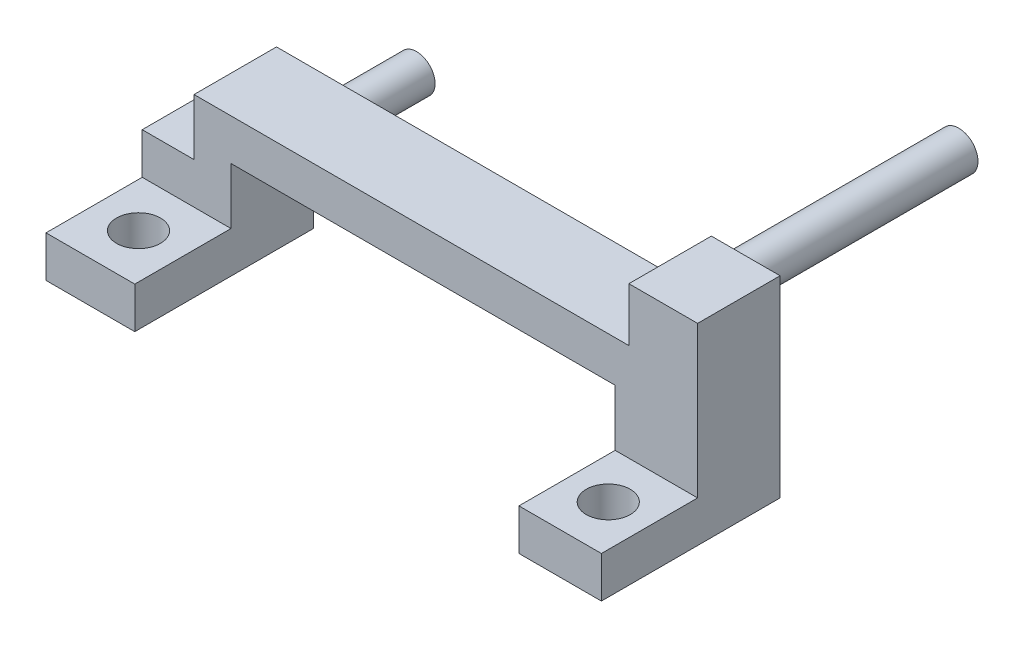
from build123d import *

# Parameters (mm, degrees)
SKETCH1_W            = 4
SKETCH1_H            = 14
BOSS_EXTRUDE1_DEPTH  = 3
SKETCH2_R            = 1.4
BOSS_EXTRUDE2_DEPTH  = 16
SKETCH3_W            = 4
SKETCH3_H            = 1
BOSS_EXTRUDE4_DEPTH  = 6
SKETCH7_W            = 3
SKETCH7_H            = 2
BOSS_EXTRUDE5_DEPTH  = 30.95
SKETCH8_W            = 3
SKETCH8_H            = 2
BOSS_EXTRUDE6_DEPTH  = 1
SKETCH9_W            = 1
SKETCH9_H            = 2
BOSS_EXTRUDE7_DEPTH  = 3
SKETCH10_W           = 1
SKETCH10_H           = 2
BOSS_EXTRUDE8_DEPTH  = 5.92
SKETCH11_W           = 1
SKETCH11_H           = 2
BOSS_EXTRUDE9_DEPTH  = 4
SKETCH12_W           = 1
SKETCH12_H           = 3
BOSS_EXTRUDE14_DEPTH = 0.93
SKETCH13_W           = 3
SKETCH13_H           = 3
BOSS_EXTRUDE15_DEPTH = 7.1
SKETCH14_W           = 3.33402541
SKETCH14_H           = 13.860919233
CUT_EXTRUDE3_DEPTH   = 10
SKETCH15_W           = 6.20666024
SKETCH15_H           = 3.660501205
CUT_EXTRUDE4_DEPTH   = 10
SKETCH16_W           = 3
SKETCH16_H           = 9.1
BOSS_EXTRUDE16_DEPTH = 0.12
SKETCH18_W           = 3
SKETCH18_H           = 9.1
BOSS_EXTRUDE18_DEPTH = 0.41
SKETCH19_W           = 3
SKETCH19_H           = 9.1
BOSS_EXTRUDE19_DEPTH = 0.89
SKETCH20_W           = 3
SKETCH20_H           = 6
BOSS_EXTRUDE20_DEPTH = 3.77
SKETCH21_R           = 1.35
BOSS_EXTRUDE23_DEPTH = 10
BOSS_EXTRUDE24_DEPTH = 3
SKETCH24_W           = 4
SKETCH24_H           = 1
BOSS_EXTRUDE25_DEPTH = 4
SKETCH25_W           = 4
SKETCH25_H           = 7
BOSS_EXTRUDE26_DEPTH = 2
SKETCH26_W           = 6.458993184
SKETCH26_H           = 3
BOSS_EXTRUDE27_DEPTH = 7
SKETCH27_R           = 1.6
CUT_EXTRUDE5_DEPTH   = 7
SKETCH28_R           = 1.6
CUT_EXTRUDE6_DEPTH   = 7
SKETCH30_W           = 7
SKETCH30_H           = 3
BOSS_EXTRUDE29_DEPTH = 1
SKETCH31_W           = 7
SKETCH31_H           = 3
BOSS_EXTRUDE30_DEPTH = 1
SKETCH32_W           = 6
SKETCH32_H           = 7.1
BOSS_EXTRUDE31_DEPTH = 1
SKETCH33_W           = 31.638993184
SKETCH33_H           = 6
BOSS_EXTRUDE32_DEPTH = 1
SKETCH34_W           = 6
SKETCH34_H           = 14
BOSS_EXTRUDE33_DEPTH = 1


with BuildPart() as part:
    # Sketch1 → Boss-Extrude1 (new body)
    with BuildSketch(Plane.XY):
        with Locations((-1.434146341, -3.597560976)):
            Rectangle(SKETCH1_W, SKETCH1_H)
    extrude(amount=BOSS_EXTRUDE1_DEPTH)

    # Sketch2 → Boss-Extrude2 (add)
    with BuildSketch(Plane(origin=(0, 0, 0), x_dir=(-1, 0, 0), z_dir=(0, 0, -1))):
        with Locations((1.434146341, 1.802439024)):
            Circle(SKETCH2_R)
    extrude(amount=BOSS_EXTRUDE2_DEPTH)

    # Sketch3 → Boss-Extrude4 (add)
    with BuildSketch(Plane.XY.offset(3)):
        with Locations((-1.434146341, -10.097560976)):
            Rectangle(SKETCH3_W, SKETCH3_H)
    extrude(amount=BOSS_EXTRUDE4_DEPTH)

    # Sketch7 → Boss-Extrude5 (add)
    with BuildSketch(Plane.ZY.offset(3.434146341)):
        with Locations((1.5, -2.497560976)):
            Rectangle(SKETCH7_W, SKETCH7_H)
    extrude(amount=BOSS_EXTRUDE5_DEPTH)

    # Sketch8 → Boss-Extrude6 (add)
    with BuildSketch(Plane.ZY.offset(34.384146341)):
        with Locations((1.5, -2.497560976)):
            Rectangle(SKETCH8_W, SKETCH8_H)
    extrude(amount=BOSS_EXTRUDE6_DEPTH)

    # Sketch9 → Boss-Extrude7 (add)
    with BuildSketch(Plane(origin=(0, 0, 0), x_dir=(-1, 0, 0), z_dir=(0, 0, -1))):
        with Locations((34.884146341, -2.497560976)):
            Rectangle(SKETCH9_W, SKETCH9_H)
    extrude(amount=BOSS_EXTRUDE7_DEPTH)

    # Sketch10 → Boss-Extrude8 (add)
    with BuildSketch(Plane(origin=(0, 0, -3), x_dir=(-1, 0, 0), z_dir=(0, 0, -1))):
        with Locations((34.884146341, -2.497560976)):
            Rectangle(SKETCH10_W, SKETCH10_H)
    extrude(amount=BOSS_EXTRUDE8_DEPTH)

    # Sketch11 → Boss-Extrude9 (add)
    with BuildSketch(Plane(origin=(0, 0, -8.92), x_dir=(-1, 0, 0), z_dir=(0, 0, -1))):
        with Locations((34.884146341, -2.497560976)):
            Rectangle(SKETCH11_W, SKETCH11_H)
    extrude(amount=BOSS_EXTRUDE9_DEPTH)

    # Sketch12 → Boss-Extrude14 (add)
    with BuildSketch(Plane.XZ.offset(3.497560976)):
        with Locations((-34.884146341, -9.28)):
            Rectangle(SKETCH12_W, SKETCH12_H)
    extrude(amount=BOSS_EXTRUDE14_DEPTH)

    # Sketch13 → Boss-Extrude15 (add)
    with BuildSketch(Plane.XZ.offset(3.497560976)):
        with Locations((-33.884146341, 1.5)):
            Rectangle(SKETCH13_W, SKETCH13_H)
    extrude(amount=BOSS_EXTRUDE15_DEPTH)

    # Sketch14 → Cut-Extrude3 (cut)
    with BuildSketch(Plane.XY.offset(3)):
        with Locations((-35.32015223, -3.66710136)):
            Rectangle(SKETCH14_W, SKETCH14_H)
    extrude(amount=-CUT_EXTRUDE3_DEPTH, mode=Mode.SUBTRACT)


with BuildPart() as cut_extrude3_piece_1:
    # of the separate pieces the step leaves, piece 1, a body of its own (cut_extrude3_pieces)
    add(part.part.solids().sort_by_distance((-3.434146341, 3.402439024, 0))[0])

    # Sketch16 → Boss-Extrude16 (add)
    with BuildSketch(Plane.ZY.offset(33.653139525)):
        with Locations((1.5, -6.047560976)):
            Rectangle(SKETCH16_W, SKETCH16_H)
    extrude(amount=BOSS_EXTRUDE16_DEPTH)

    # Sketch18 → Boss-Extrude18 (add)
    with BuildSketch(Plane.ZY.offset(33.773139525)):
        with Locations((1.5, -6.047560976)):
            Rectangle(SKETCH18_W, SKETCH18_H)
    extrude(amount=BOSS_EXTRUDE18_DEPTH)

    # Sketch19 → Boss-Extrude19 (add)
    with BuildSketch(Plane.ZY.offset(34.183139525)):
        with Locations((1.5, -6.047560976)):
            Rectangle(SKETCH19_W, SKETCH19_H)
    extrude(amount=BOSS_EXTRUDE19_DEPTH)

    # Sketch20 → Boss-Extrude20 (add)
    with BuildSketch(Plane.ZY.offset(35.073139525)):
        with Locations((1.5, -7.597560976)):
            Rectangle(SKETCH20_W, SKETCH20_H)
    extrude(amount=BOSS_EXTRUDE20_DEPTH)

    # Sketch21 → Boss-Extrude23 (add)
    with BuildSketch(Plane(origin=(0, 0, 0), x_dir=(-1, 0, 0), z_dir=(0, 0, -1))):
        with Locations((34.884146341, -7.047560976)):
            Circle(SKETCH21_R)
    extrude(amount=BOSS_EXTRUDE23_DEPTH)

    # Sketch23 → Boss-Extrude24 (add)
    with BuildSketch(Plane.XY.offset(3)):
        Polygon((-38.843139525, -10.597560976), (-38.843139525, -4.597560976), (-35.073139525, -4.597560976), (-35.073139525, -1.497560976), (-3.434146341, -1.497560976), (-3.434146341, 3.402439024), (0.565853659, 3.402439024), (0.565853659, -9.597560976), (-3.434146341, -9.597560976), (-3.434146341, -3.497560976), (-32.384146341, -3.497560976), (-32.384146341, -10.597560976), align=None)
    extrude(amount=BOSS_EXTRUDE24_DEPTH)

    # Sketch24 → Boss-Extrude25 (add)
    with BuildSketch(Plane.XY.offset(9)):
        with Locations((-1.434146341, -10.097560976)):
            Rectangle(SKETCH24_W, SKETCH24_H)
    extrude(amount=BOSS_EXTRUDE25_DEPTH)

    # Sketch25 → Boss-Extrude26 (add)
    with BuildSketch(Plane(origin=(0, -9.597560976, 0), x_dir=(1, 0, 0), z_dir=(0, 1, 0))):
        with Locations((-1.434146341, -9.5)):
            Rectangle(SKETCH25_W, SKETCH25_H)
    extrude(amount=BOSS_EXTRUDE26_DEPTH)

    # Sketch26 → Boss-Extrude27 (add)
    with BuildSketch(Plane.XY.offset(6)):
        with Locations((-35.613642933, -9.097560976)):
            Rectangle(SKETCH26_W, SKETCH26_H)
    extrude(amount=BOSS_EXTRUDE27_DEPTH)

    # Sketch27 → Cut-Extrude5 (cut)
    with BuildSketch(Plane(origin=(0, -7.597560976, 0), x_dir=(1, 0, 0), z_dir=(0, 1, 0))):
        with Locations((-35.613642933, -9.5)):
            Circle(SKETCH27_R)
    extrude(amount=-CUT_EXTRUDE5_DEPTH, mode=Mode.SUBTRACT)

    # Sketch28 → Cut-Extrude6 (cut)
    with BuildSketch(Plane(origin=(0, -7.597560976, 0), x_dir=(1, 0, 0), z_dir=(0, 1, 0))):
        with Locations((-1.434146341, -9.5)):
            Circle(SKETCH28_R)
    extrude(amount=-CUT_EXTRUDE6_DEPTH, mode=Mode.SUBTRACT)

    # Sketch30 → Boss-Extrude29 (add)
    with BuildSketch(Plane(origin=(0.565853659, 0, 0), x_dir=(0, 0, -1), z_dir=(1, 0, 0))):
        with Locations((-9.5, -9.097560976)):
            Rectangle(SKETCH30_W, SKETCH30_H)
    extrude(amount=BOSS_EXTRUDE29_DEPTH)

    # Sketch31 → Boss-Extrude30 (add)
    with BuildSketch(Plane.ZY.offset(3.434146341)):
        with Locations((9.5, -9.097560976)):
            Rectangle(SKETCH31_W, SKETCH31_H)
    extrude(amount=BOSS_EXTRUDE30_DEPTH)

    # Sketch32 → Boss-Extrude31 (add)
    with BuildSketch(Plane.ZY.offset(3.434146341)):
        with Locations((3, -7.047560976)):
            Rectangle(SKETCH32_W, SKETCH32_H)
    extrude(amount=BOSS_EXTRUDE31_DEPTH)

    # Sketch33 → Boss-Extrude32 (add)
    with BuildSketch(Plane(origin=(0, -1.497560976, 0), x_dir=(1, 0, 0), z_dir=(0, 1, 0))):
        with Locations((-19.253642933, -3)):
            Rectangle(SKETCH33_W, SKETCH33_H)
    extrude(amount=BOSS_EXTRUDE32_DEPTH)

    # Sketch34 → Boss-Extrude33 (add)
    with BuildSketch(Plane(origin=(0.565853659, 0, 0), x_dir=(0, 0, -1), z_dir=(1, 0, 0))):
        with Locations((-3, -3.597560976)):
            Rectangle(SKETCH34_W, SKETCH34_H)
    extrude(amount=BOSS_EXTRUDE33_DEPTH)


with BuildPart() as cut_extrude3_piece_2:
    # of the separate pieces the step leaves, piece 2, a body of its own (cut_extrude3_pieces)
    add(part.part.solids().sort_by_distance((-34.384146341, -1.497560976, -7))[0])

    # Sketch15 → Cut-Extrude4 (cut)
    with BuildSketch(Plane.ZY.offset(35.384146341)):
        with Locations((-9.81666988, -3.327811578)):
            Rectangle(SKETCH15_W, SKETCH15_H)
    extrude(amount=-CUT_EXTRUDE4_DEPTH, mode=Mode.SUBTRACT)


solid = cut_extrude3_piece_1.part
